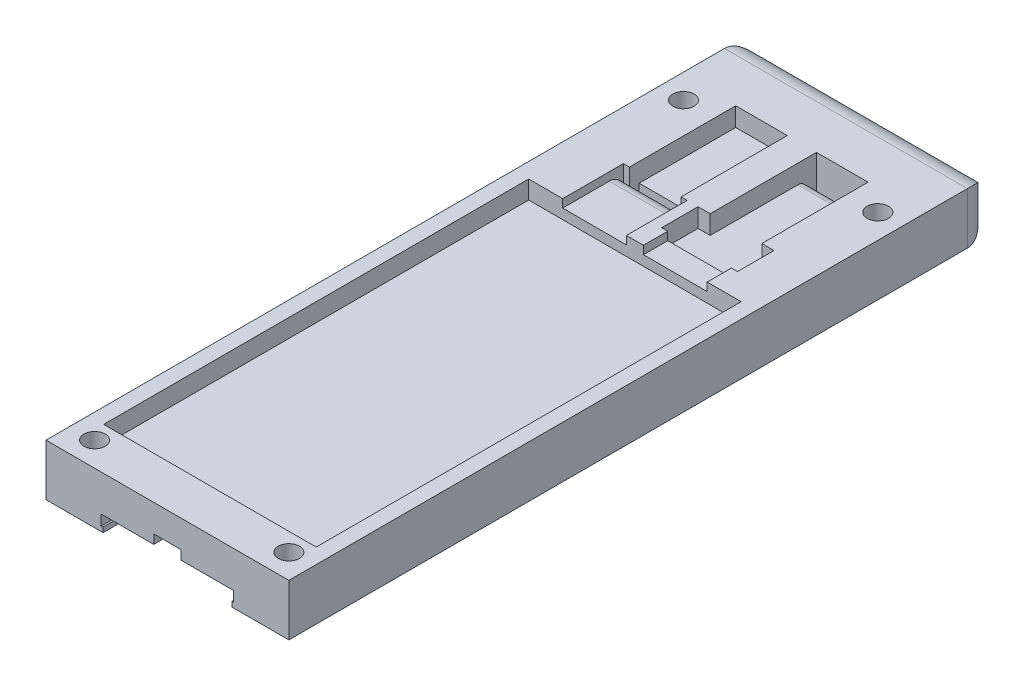
from build123d import *

# Parameters (mm, degrees)
SKETCH1_W                  = 40
SKETCH1_H                  = 106
BOSS_EXTRUDE1_DEPTH        = 8.5
SKETCH2_W                  = 35
SKETCH2_H                  = 70
CUT_EXTRUDE1_DEPTH         = 3
SKETCH3_W                  = 10.5
SKETCH3_H                  = 10
CUT_EXTRUDE2_DEPTH         = 1.35
SKETCH4_W                  = 12.5
SKETCH4_H                  = 6
CUT_EXTRUDE3_DEPTH         = 3.1
SKETCH5_W                  = 8.5
SKETCH5_H                  = 17.5
PCB_PLACE_DEPTH            = 3.1
SKETCH6_W                  = 8.5
SKETCH6_H                  = 1.6
NICKEL_STRIP_HOLE_DEPTH    = 70.174850921
CUT_EXTRUDE4_REACH         = 71.486
SKETCH7_W                  = 8.5
SKETCH7_H                  = 17.5
SKETCH8_W                  = 8.5
SKETCH8_H                  = 1.6
CUT_EXTRUDE5_DEPTH         = 10
SKETCH9_W                  = 8.5
SKETCH9_H                  = 106
NICKEL_STRIP_RAIL_DEPTH    = 2.5
FILLET3_R                  = 2.325
FILLET4_RADIUS             = 1.45
FILLET4_LENGTH             = 8.5
SKETCH10_W                 = 8.5
SKETCH10_H                 = 5
CUT_EXTRUDE6_DEPTH         = 1.5
SKETCH11_W                 = 8.5
SKETCH11_H                 = 0.7
NICKELSTRIPINSERTION_DEPTH = 18
FILLET5_INSERTION_START    = -10.9
FILLET5_INSERTION_DEPTH    = 8.5
FILLET5_INSERTION_START_2  = 2.4
FILLET5_INSERTION_2_DEPTH  = 8.5
FILLET7_AMEND_R            = 4
FILLET6_START              = -10.9
FILLET6_DEPTH              = 8.5
FILLET6_START_2            = 2.4
FILLET6_2_DEPTH            = 8.5
FILLET8_ROUNDING_R         = 0.1
SKETCH12_W                 = 0.3
SKETCH12_H                 = 0.8
STRIPRAIL_DEPTH            = 70
SKETCH13_R                 = 1.75
SCREW_HOLES_DEPTH          = 70.485610128
SKETCH14_R                 = 3.5
SCREW_HEAD_HOLES_TBM_DEPTH = 4.5
BOSS_EXTRUDE2_DEPTH        = 10
FILLET9_R                  = 4.25
CUT_EXTRUDE7_REACH         = 120.018
SKETCH17_W                 = 4.5
SKETCH17_H                 = 4
CUT_EXTRUDE8_REACH         = 120.018
SKETCH18_W                 = 5.4
SKETCH18_H                 = 2.5


with BuildPart() as part:
    # Sketch1 → Boss-Extrude1 (new body)
    with BuildSketch(Plane(origin=(0, 0, 0), x_dir=(1, 0, 0), z_dir=(0, 1, 0))):
        with Locations((0, 13)):
            Rectangle(SKETCH1_W, SKETCH1_H)
    extrude(amount=BOSS_EXTRUDE1_DEPTH)

    # Sketch2 → Cut-Extrude1 (cut)
    with BuildSketch(Plane(origin=(0, 8.5, 0), x_dir=(1, 0, 0), z_dir=(0, 1, 0))):
        with Locations((0, 2)):
            Rectangle(SKETCH2_W, SKETCH2_H)
    extrude(amount=-CUT_EXTRUDE1_DEPTH, mode=Mode.SUBTRACT)

    # Sketch3 → Cut-Extrude2 (cut)
    with BuildSketch(Plane(origin=(0, 8.5, 0), x_dir=(1, 0, 0), z_dir=(0, 1, 0))):
        with Locations((-6.65, 42)):
            Rectangle(SKETCH3_W, SKETCH3_H)
        with Locations((6.65, 42)):
            Rectangle(SKETCH3_W, SKETCH3_H)
    extrude(amount=-CUT_EXTRUDE2_DEPTH, mode=Mode.SUBTRACT)

    # Sketch4 → Cut-Extrude3 (cut)
    with BuildSketch(Plane(origin=(0, 8.5, 0), x_dir=(1, 0, 0), z_dir=(0, 1, 0))):
        with Locations((6.65, 44)):
            Rectangle(SKETCH4_W, SKETCH4_H)
    extrude(amount=-CUT_EXTRUDE3_DEPTH, mode=Mode.SUBTRACT)

    # Sketch5 → PCB place (cut)
    with BuildSketch(Plane(origin=(0, 8.5, 0), x_dir=(1, 0, 0), z_dir=(0, 1, 0))):
        with Locations((6.65, 55.75)):
            Rectangle(SKETCH5_W, SKETCH5_H)
    extrude(amount=-PCB_PLACE_DEPTH, mode=Mode.SUBTRACT)

    # Sketch6 → Nickel strip hole (cut, through all)
    with BuildSketch(Plane(origin=(0, 5.4, 0), x_dir=(1, 0, 0), z_dir=(0, 1, 0))):
        with Locations((6.65, 63.7)):
            Rectangle(SKETCH6_W, SKETCH6_H)
    extrude(amount=-NICKEL_STRIP_HOLE_DEPTH, mode=Mode.SUBTRACT)

    # Cut-Extrude4: up to this face of the body (flat: up to its plane)
    cut_extrude4_end = Plane(part.part.faces().sort_by_distance((6.65, 5.4, -51.042077088))[0])
    # Sketch7 → Cut-Extrude4 (cut, up to the picked face)
    with BuildSketch(Plane(origin=(0, 8.5, 0), x_dir=(1, 0, 0), z_dir=(0, 1, 0)), mode=Mode.PRIVATE) as cut_extrude4_sk1:
        with Locations((-6.65, 55.75)):
            Rectangle(SKETCH7_W, SKETCH7_H)
    cut_extrude4_tool1 = split(extrude(cut_extrude4_sk1.sketch, amount=-CUT_EXTRUDE4_REACH, mode=Mode.PRIVATE), bisect_by=cut_extrude4_end, keep=Keep.BOTH, mode=Mode.PRIVATE)
    add(cut_extrude4_tool1.solids().sort_by(Axis((-6.65, 8.5, -55.75), (0, -1, 0)))[0], mode=Mode.SUBTRACT)

    # Sketch8 → Cut-Extrude5 (cut)
    with BuildSketch(Plane(origin=(0, 5.4, 0), x_dir=(1, 0, 0), z_dir=(0, 1, 0))):
        with Locations((-6.65, 47.8)):
            Rectangle(SKETCH8_W, SKETCH8_H)
    extrude(amount=-CUT_EXTRUDE5_DEPTH, mode=Mode.SUBTRACT)

    # Sketch9 → Nickel strip rail (cut)
    with BuildSketch(Plane.XZ):
        with Locations((-6.65, -13)):
            Rectangle(SKETCH9_W, SKETCH9_H)
        with Locations((6.65, -13)):
            Rectangle(SKETCH9_W, SKETCH9_H)
    extrude(amount=-NICKEL_STRIP_RAIL_DEPTH, mode=Mode.SUBTRACT)

    # Fillet3
    # the kernel refuses this fillet: 2.325 mm, written as the material it takes off along each edge
    with BuildSketch(Plane(origin=(3.4125, 7.15, -47), x_dir=(0, 0, 1), z_dir=(-1, 0, 0))) as fillet3_piece_1_section:
        with BuildLine():
            CenterArc((FILLET3_R, -FILLET3_R), FILLET3_R, 90, 90)
            Line((0, -FILLET3_R), (0, 0))
            Line((0, 0), (FILLET3_R, 0))
        make_face()
    fillet3_piece_1 = extrude(amount=20.125, mode=Mode.PRIVATE)
    fillet3_piece_1 = split(fillet3_piece_1, bisect_by=Plane(origin=(-11.9, 7.15, -47), z_dir=(1, 0, 0)), keep=Keep.TOP, mode=Mode.PRIVATE)
    fillet3_piece_1 = split(fillet3_piece_1, bisect_by=Plane(origin=(-1.4, 7.15, -47), z_dir=(-1, 0, 0)), keep=Keep.TOP, mode=Mode.PRIVATE)
    add(fillet3_piece_1, mode=Mode.SUBTRACT)
    with BuildSketch(Plane(origin=(-10.9, 2.5, -47), x_dir=(0, 1, 0), z_dir=(1, 0, 0))) as fillet3_piece_2:
        with BuildLine():
            CenterArc((FILLET3_R, FILLET3_R), FILLET3_R, 180, 90)
            Line((0, FILLET3_R), (0, 0))
            Line((0, 0), (FILLET3_R, 0))
        make_face()
    extrude(amount=8.5, mode=Mode.SUBTRACT)

    # Fillet4: full round fillet: the end face becomes a half cylinder, R = half its width
    fillet4_face = Plane((6.65, 3.95, -62.9), x_dir=(1, 0, 0), z_dir=(0, 0, -1))  # on the end face: x along it, z out of the body
    fillet4_slab = fillet4_face.offset(-FILLET4_RADIUS / 2) * Box(FILLET4_LENGTH, 2 * FILLET4_RADIUS, FILLET4_RADIUS, mode=Mode.PRIVATE)  # the body's end, R deep
    fillet4_round = Plane((6.65, 3.95, -61.45), x_dir=(0, 0, -1), z_dir=(1, 0, 0)) * Cylinder(FILLET4_RADIUS, FILLET4_LENGTH, mode=Mode.PRIVATE)  # its axis R under the face
    add(fillet4_slab - fillet4_round, mode=Mode.SUBTRACT)

    # Sketch10 → Cut-Extrude6 (cut)
    with BuildSketch(Plane.XZ.offset(-2.5)):
        with Locations((6.65, 6.5)):
            Rectangle(SKETCH10_W, SKETCH10_H)
        with Locations((-6.65, 6.5)):
            Rectangle(SKETCH10_W, SKETCH10_H)
    extrude(amount=-CUT_EXTRUDE6_DEPTH, mode=Mode.SUBTRACT)

    # Sketch11 → NickelStripInsertion (cut)
    with BuildSketch(Plane(origin=(0, 0, 9), x_dir=(-1, 0, 0), z_dir=(0, 0, -1))):
        with Locations((-6.65, 3.65)):
            Rectangle(SKETCH11_W, SKETCH11_H)
        with Locations((6.65, 3.65)):
            Rectangle(SKETCH11_W, SKETCH11_H)
    extrude(amount=-NICKELSTRIPINSERTION_DEPTH, mode=Mode.SUBTRACT)

    # Fillet5_insertion: read off the stored shape, not the designer's step
    # Fillet5_insertion outline → Fillet5_insertion (cut)
    with BuildSketch(Plane.YZ.offset(FILLET5_INSERTION_START)):
        with BuildLine():
            Line((2.5, 4), (2.5, -8.359207094))
            add(Edge.make_bspline(
                [(2.5, -8.359207094), (2.5, 2.968380423), (4, 4)],
                knots=[0, 0, 0, 1, 1, 1], degree=2, weights=[1, 0.885061203, 1]))
            Line((4, 4), (2.5, 4))
        make_face()
    extrude(amount=FILLET5_INSERTION_DEPTH, mode=Mode.SUBTRACT)

    # Fillet5_insertion 2 outline → Fillet5_insertion 2 (cut)
    with BuildSketch(Plane.YZ.offset(FILLET5_INSERTION_START_2)):
        with BuildLine():
            Line((2.5, 4), (2.5, -8.359207094))
            add(Edge.make_bspline(
                [(2.5, -8.359207094), (2.5, 2.968380423), (4, 4)],
                knots=[0, 0, 0, 1, 1, 1], degree=2, weights=[1, 0.885061203, 1]))
            Line((4, 4), (2.5, 4))
        make_face()
    extrude(amount=FILLET5_INSERTION_2_DEPTH, mode=Mode.SUBTRACT)

    # Fillet7_amend
    fillet7_amend_edges = [part.edges().sort_by_distance(p)[0] for p in [
        (6.65, 4, 4),
        (-6.65, 4, 4),
    ]]
    fillet(fillet7_amend_edges, radius=FILLET7_AMEND_R)

    # Fillet6: read off the stored shape, not the designer's step
    # Fillet6 outline → Fillet6 (cut)
    with BuildSketch(Plane.YZ.offset(FILLET6_START)):
        with BuildLine():
            Line((3.3, 9), (3.3, 16.909487973))
            add(Edge.make_bspline(
                [(3.3, 16.909487973), (3.3, 9.121373217), (2.5, 9)],
                knots=[0, 0, 0, 1, 1, 1], degree=2, weights=[1, 0.758287544, 1]))
            Line((2.5, 9), (3.3, 9))
        make_face()
    extrude(amount=FILLET6_DEPTH, mode=Mode.SUBTRACT)

    # Fillet6 2 outline → Fillet6 2 (cut)
    with BuildSketch(Plane.YZ.offset(FILLET6_START_2)):
        with BuildLine():
            Line((3.3, 9), (3.3, 16.909487973))
            add(Edge.make_bspline(
                [(3.3, 16.909487973), (3.3, 9.121373217), (2.5, 9)],
                knots=[0, 0, 0, 1, 1, 1], degree=2, weights=[1, 0.758287544, 1]))
            Line((2.5, 9), (3.3, 9))
        make_face()
    extrude(amount=FILLET6_2_DEPTH, mode=Mode.SUBTRACT)

    # Fillet8_rounding
    fillet8_rounding_edges = [part.edges().sort_by_distance(p)[0] for p in [
        (-6.65, 2.5, 9),
        (6.65, 2.5, 9),
    ]]
    fillet(fillet8_rounding_edges, radius=FILLET8_ROUNDING_R)

    # Sketch12 → StripRail (add)
    with BuildSketch(Plane.XY.offset(40)):
        with Locations((2.55, 0.4)):
            Rectangle(SKETCH12_W, SKETCH12_H)
        with Locations((-10.75, 0.4)):
            Rectangle(SKETCH12_W, SKETCH12_H)
        with Locations((-2.55, 0.4)):
            Rectangle(SKETCH12_W, SKETCH12_H)
        with Locations((10.75, 0.4)):
            Rectangle(SKETCH12_W, SKETCH12_H)
    extrude(amount=-STRIPRAIL_DEPTH)

    # Sketch13 → Screw_Holes (cut, through all)
    with BuildSketch(Plane.XZ):
        with Locations(Location((-16, -61, 0), (0, 0, 270))):
            Circle(SKETCH13_R)
        with Locations(Location((16, -61, 0), (0, 0, 270))):
            Circle(SKETCH13_R)
        with Locations(Location((-16, 36, 0), (0, 0, 270))):
            Circle(SKETCH13_R)
        with Locations(Location((16, 36, 0), (0, 0, 270))):
            Circle(SKETCH13_R)
    extrude(amount=-SCREW_HOLES_DEPTH, mode=Mode.SUBTRACT)

    # Sketch14 → Screw_Head_Holes_TBM (cut)
    with BuildSketch(Plane.XZ):
        with Locations(Location((16, -61, 0), (0, 0, 270))):
            Circle(SKETCH14_R)
        with Locations(Location((-16, -61, 0), (0, 0, 270))):
            Circle(SKETCH14_R)
        with Locations(Location((16, 36, 0), (0, 0, 270))):
            Circle(SKETCH14_R)
        with Locations(Location((-16, 36, 0), (0, 0, 270))):
            Circle(SKETCH14_R)
    extrude(amount=-SCREW_HEAD_HOLES_TBM_DEPTH, mode=Mode.SUBTRACT)

    # Sketch15 → Boss-Extrude2 (add)
    with BuildSketch(Plane(origin=(0, 0, -66), x_dir=(-1, 0, 0), z_dir=(0, 0, -1))):
        Polygon((-20, 0), (-20, 8.5), (20, 8.5), (20, 0), (10.9, 0), (10.9, 2.5), (2.4, 2.5), (2.4, 0), (-2.4, 0), (-2.4, 2.5), (-10.9, 2.5), (-10.9, 0), align=None)
    extrude(amount=BOSS_EXTRUDE2_DEPTH)

    # Fillet9
    # the kernel refuses this fillet: 4.25 mm, written as the material it takes off along each edge
    with BuildSketch(Plane(origin=(0.275, 0, -76), x_dir=(0, 0, 1), z_dir=(1, 0, 0))) as fillet9_piece_1:
        with BuildLine():
            CenterArc((FILLET9_R, -FILLET9_R), FILLET9_R, 90, 90)
            Line((0, -FILLET9_R), (0, 0))
            Line((0, 0), (FILLET9_R, 0))
        make_face()
    extrude(amount=30.35, mode=Mode.SUBTRACT)
    with BuildSketch(Plane(origin=(-13.025, 0, -76), x_dir=(0, 0, 1), z_dir=(1, 0, 0))) as fillet9_piece_2:
        with BuildLine():
            CenterArc((FILLET9_R, -FILLET9_R), FILLET9_R, 90, 90)
            Line((0, -FILLET9_R), (0, 0))
            Line((0, 0), (FILLET9_R, 0))
        make_face()
    extrude(amount=26.05, mode=Mode.SUBTRACT)
    with BuildSketch(Plane(origin=(-30.625, 0, -76), x_dir=(0, 1, 0), z_dir=(1, 0, 0))) as fillet9_piece_3:
        with BuildLine():
            CenterArc((FILLET9_R, FILLET9_R), FILLET9_R, 180, 90)
            Line((0, FILLET9_R), (0, 0))
            Line((0, 0), (FILLET9_R, 0))
        make_face()
    extrude(amount=30.35, mode=Mode.SUBTRACT)
    with BuildSketch(Plane(origin=(-20, 19.125, -76), x_dir=(0, 0, 1), z_dir=(0, -1, 0)), Plane(origin=(20, -10.625, -76), x_dir=(0, 0, 1), z_dir=(0, 1, 0))) as fillet9_piece_4:
        with BuildLine():
            CenterArc((FILLET9_R, -FILLET9_R), FILLET9_R, 90, 90)
            Line((0, -FILLET9_R), (0, 0))
            Line((0, 0), (FILLET9_R, 0))
        make_face()
    extrude(amount=29.75, mode=Mode.SUBTRACT)
    with BuildSketch(Plane(origin=(30.625, 8.5, -76), x_dir=(0, 0, 1), z_dir=(-1, 0, 0))) as fillet9_piece_5:
        with BuildLine():
            CenterArc((FILLET9_R, -FILLET9_R), FILLET9_R, 90, 90)
            Line((0, -FILLET9_R), (0, 0))
            Line((0, 0), (FILLET9_R, 0))
        make_face()
    extrude(amount=61.25, mode=Mode.SUBTRACT)

    # Sketch17 → Cut-Extrude7 (cut, up to next)
    with BuildSketch(Plane.XY.offset(40), mode=Mode.PRIVATE) as cut_extrude7_sk1:
        with Locations((0, 2)):
            Rectangle(SKETCH17_W, SKETCH17_H)
    cut_extrude7_tool1 = extrude(cut_extrude7_sk1.sketch, amount=-CUT_EXTRUDE7_REACH, mode=Mode.PRIVATE) & part.part
    add(cut_extrude7_tool1.solids().sort_by_distance((0, 2, 40))[0], mode=Mode.SUBTRACT)

    # Sketch18 → Cut-Extrude8 (cut, up to next)
    with BuildSketch(Plane.XY.offset(40), mode=Mode.PRIVATE) as cut_extrude8_sk1:
        with Locations((0, 1.25)):
            Rectangle(SKETCH18_W, SKETCH18_H)
    cut_extrude8_tool1 = extrude(cut_extrude8_sk1.sketch, amount=-CUT_EXTRUDE8_REACH, mode=Mode.PRIVATE) & part.part
    add(cut_extrude8_tool1.solids().sort_by_distance((0, 1.25, 40))[0], mode=Mode.SUBTRACT)
    add(cut_extrude8_tool1.solids().sort_by_distance((0, 1.25, 40))[1], mode=Mode.SUBTRACT)


solid = part.part
